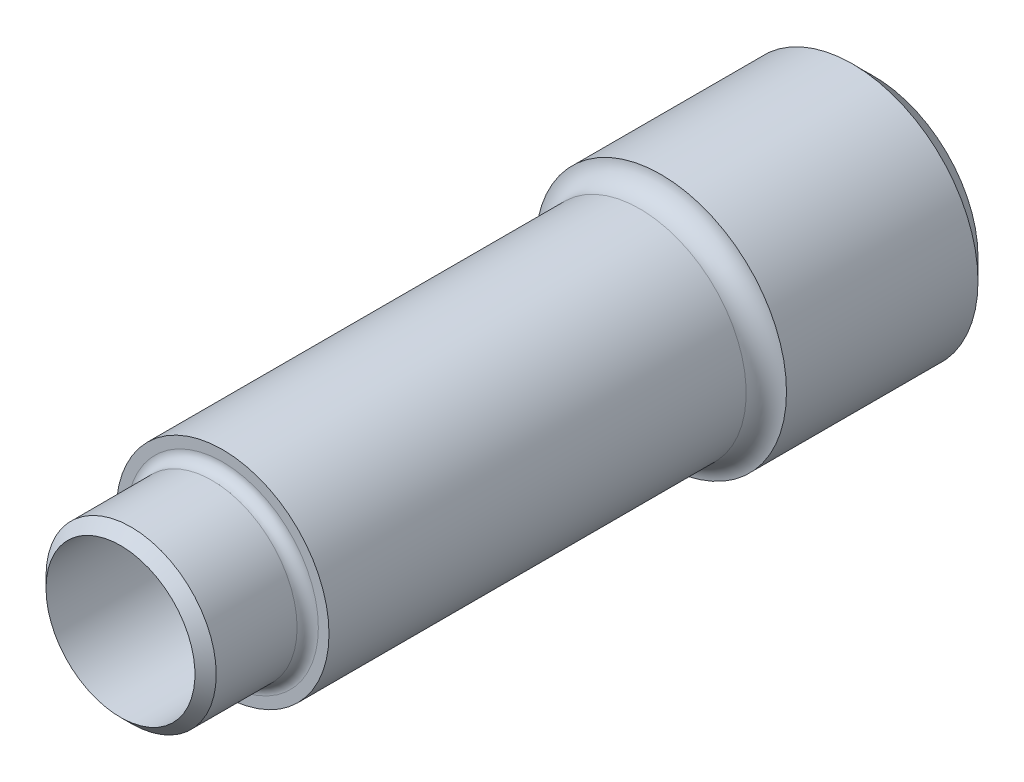
from build123d import *

# Parameters (mm, degrees)
SKETCH1_R           = 12.7
BOSS_EXTRUDE1_DEPTH = 89.916
SKETCH2_R           = 8.89
CUT_EXTRUDE1_DEPTH  = 92.69224098
SKETCH3_R           = 10.033
CUT_EXTRUDE2_DEPTH  = 12.7
CUT_EXTRUDE3_START  = -12.192
SKETCH4_R           = 12.7
SKETCH4_R_2         = 10.16
CUT_EXTRUDE3_DEPTH  = 12.192
FILLET1_R           = 1.27
CHAMFER1_SIZE       = 1.27
FILLET2_R           = 0.635
CHAMFER2_SIZE       = 1.27
SKETCH5_R           = 14.986
SKETCH5_R_2         = 12.7
BOSS_EXTRUDE2_DEPTH = 25.4
FILLET3_R           = 2.54
CHAMFER3_SIZE       = 2.54


# Some blends are built 0.0001 mm under size
with BuildPart() as part:
    # Sketch1 → Boss-Extrude1 (new body)
    with BuildSketch(Plane.XY):
        Circle(SKETCH1_R)
    extrude(amount=BOSS_EXTRUDE1_DEPTH)

    # Sketch2 → Cut-Extrude1 (cut, through all)
    with BuildSketch(Plane(origin=(0, 0, 0), x_dir=(-1, 0, 0), z_dir=(0, 0, -1))):
        Circle(SKETCH2_R)
    extrude(amount=-CUT_EXTRUDE1_DEPTH, mode=Mode.SUBTRACT)

    # Sketch3 → Cut-Extrude2 (cut)
    with BuildSketch(Plane(origin=(0, 0, 0), x_dir=(-1, 0, 0), z_dir=(0, 0, -1))):
        Circle(SKETCH3_R)
    extrude(amount=-CUT_EXTRUDE2_DEPTH, mode=Mode.SUBTRACT)

    # Sketch4 → Cut-Extrude3 (cut)
    with BuildSketch(Plane.XY.offset(89.916).offset(CUT_EXTRUDE3_START)):
        Circle(SKETCH4_R)
        Circle(SKETCH4_R_2, mode=Mode.SUBTRACT)
    extrude(amount=CUT_EXTRUDE3_DEPTH, mode=Mode.SUBTRACT)

    # Fillet1
    fillet1_edges = [part.edges().sort_by_distance(p)[0] for p in [
        (-10.16, 0, 77.724),
    ]]
    fillet(fillet1_edges, radius=FILLET1_R)

    # Chamfer1
    chamfer1_edges = [part.edges().sort_by_distance(p)[0] for p in [
        (10.033, 0, 0),
    ]]
    chamfer(chamfer1_edges, length=CHAMFER1_SIZE)

    # Fillet2
    fillet2_edges = [part.edges().sort_by_distance(p)[0] for p in [
        (10.033, 0, 12.7),
    ]]
    fillet(fillet2_edges, radius=FILLET2_R)

    # Chamfer2
    chamfer2_edges = [part.edges().sort_by_distance(p)[0] for p in [
        (-10.16, 0, 89.916),
    ]]
    chamfer(chamfer2_edges, length=CHAMFER2_SIZE - 0.0001)  # a hair under: the kernel refuses the full size

    # Sketch5 → Boss-Extrude2 (add)
    with BuildSketch(Plane(origin=(0, 0, 0), x_dir=(-1, 0, 0), z_dir=(0, 0, -1))):
        Circle(SKETCH5_R)
        Circle(SKETCH5_R_2, mode=Mode.SUBTRACT)
    extrude(amount=-BOSS_EXTRUDE2_DEPTH)

    # Fillet3
    # the kernel refuses this fillet: 2.54 mm, written as the material it adds along each edge
    with BuildSketch(Plane(origin=(0, 0, 25.4), x_dir=(1, 0, 0), z_dir=(0, -1, 0))) as fillet3_piece_1:
        with BuildLine():
            CenterArc((15.24, 2.52726809), FILLET3_R, 180, 84.260829523)
            Line((12.7, 2.52726809), (12.6492, 2.52726809))
            Line((12.6492, 2.52726809), (12.6492, 0))
            Line((12.6492, 0), (12.7, -0.0508))
            ThreePointArc((12.7, -0.0508), (13.843, -0.0508), (14.98092, -0.050545362))
            Line((14.98092, -0.050545362), (14.986, 0))
        make_face()
    revolve(axis=Axis((0, 0, 25.4), (0, 0, 1)))

    # Chamfer3
    chamfer3_edges = [part.edges().sort_by_distance(p)[0] for p in [
        (14.986, 0, 0),
    ]]
    chamfer(chamfer3_edges, length=CHAMFER3_SIZE)


solid = part.part
